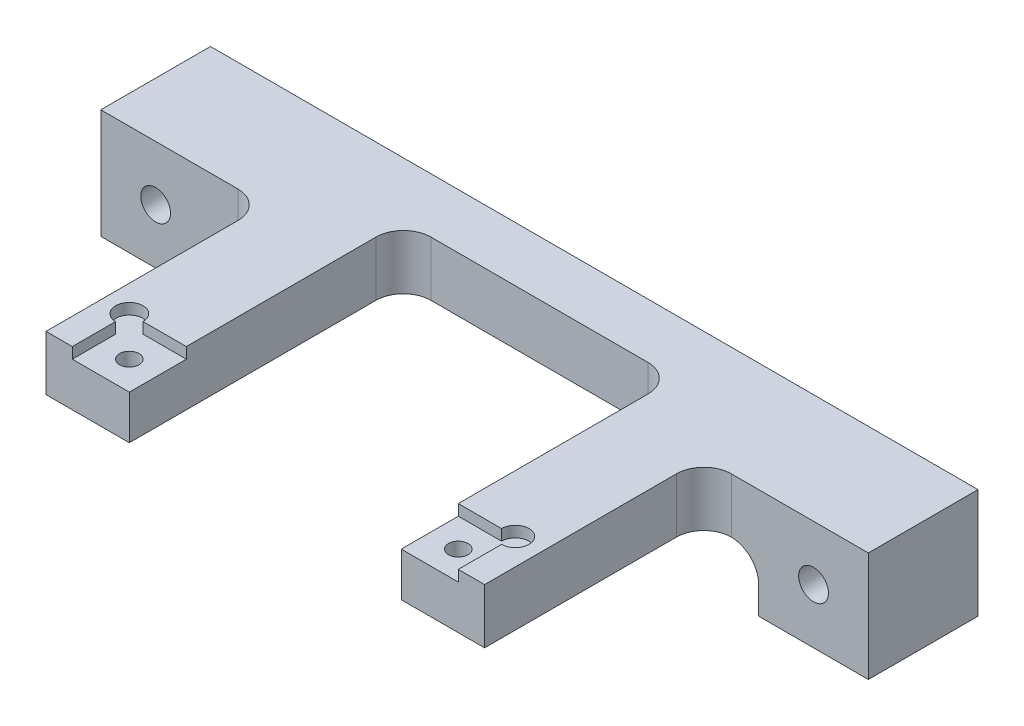
from build123d import *

# Parameters (mm, degrees)
SKETCH1_W             = 88.9
SKETCH1_H             = 38.1
BOSS_EXTRUDE1_DEPTH   = 12.7
SKETCH2_W             = 19.05
SKETCH2_H             = 25.4
CUT_EXTRUDE2_DEPTH    = 50.99995
SKETCH5_W             = 31.496
SKETCH5_H             = 31.75
CUT_EXTRUDE3_DEPTH    = 50.99995
BOSS_EXTRUDE2_START   = -6.35
BOSS_EXTRUDE2_DEPTH   = 6.35
SKETCH7_W             = 6.604
SKETCH7_H             = 6.604
CUT_EXTRUDE4_DEPTH    = 1.27
F_4_40_TAPPED_HOLE2_D = 2.2606
F_8_32_TAPPED_HOLE1_D = 3.4544
SKETCH20_R            = 1.5875
CUT_EXTRUDE5_DEPTH    = 1.27
FILLET3_R             = 3.175
SKETCH21_W            = 6.35
SKETCH21_H            = 12.7
CUT_EXTRUDE6_DEPTH    = 6.35
FILLET4_R             = 3.175
FILLET5_R             = 3.175
FILLET6_R             = 3.175
FILLET7_R             = 3.175


# Read off the part's stored shape, not the designer's step: Boss-Extrude2
with BuildPart() as part:
    # Sketch1 → Boss-Extrude1 (new body)
    with BuildSketch(Plane(origin=(0, 0, 0), x_dir=(1, 0, 0), z_dir=(0, 1, 0))):
        Rectangle(SKETCH1_W, SKETCH1_H)
    extrude(amount=-BOSS_EXTRUDE1_DEPTH)

    # Sketch2 → Cut-Extrude2 (cut, through all)
    with BuildSketch(Plane(origin=(0, 0, 0), x_dir=(1, 0, 0), z_dir=(0, 1, 0))):
        with Locations((-34.925, -6.35)):
            Rectangle(SKETCH2_W, SKETCH2_H)
        with Locations((34.925, -6.35)):
            Rectangle(SKETCH2_W, SKETCH2_H)
    extrude(amount=-CUT_EXTRUDE2_DEPTH, mode=Mode.SUBTRACT)

    # Sketch5 → Cut-Extrude3 (cut, through all)
    with BuildSketch(Plane(origin=(0, 0, 0), x_dir=(1, 0, 0), z_dir=(0, 1, 0))):
        with Locations((0, -3.175)):
            Rectangle(SKETCH5_W, SKETCH5_H)
    extrude(amount=-CUT_EXTRUDE3_DEPTH, mode=Mode.SUBTRACT)

    # Boss-Extrude2 outline → Boss-Extrude2 (cut)
    with BuildSketch(Plane.XZ.offset(12.7).offset(BOSS_EXTRUDE2_START)):
        Polygon((-25.4, 19.05), (-25.4, -19.05), (25.4, -19.05), (25.4, 19.05), (15.748, 19.05), (15.748, -12.7), (-15.748, -12.7), (-15.748, 19.05), align=None)
    extrude(amount=BOSS_EXTRUDE2_DEPTH, mode=Mode.SUBTRACT)

    # Sketch7 → Cut-Extrude4 (cut)
    with BuildSketch(Plane(origin=(0, 0, 0), x_dir=(1, 0, 0), z_dir=(0, 1, 0))):
        with Locations((-19.05, -15.748)):
            Rectangle(SKETCH7_W, SKETCH7_H)
        with Locations((19.05, -15.748)):
            Rectangle(SKETCH7_W, SKETCH7_H)
    extrude(amount=-CUT_EXTRUDE4_DEPTH, mode=Mode.SUBTRACT)

    # #4-40 Tapped Hole2 (through all)
    with Locations(Plane(origin=(-19.05, -1.27, 15.748), x_dir=(0, 0, 1), z_dir=(0, 1, 0))):
        with Locations((0, 0), (0, 38.1)):
            Hole(F_4_40_TAPPED_HOLE2_D / 2)

    # #8-32 Tapped Hole1 (through all)
    with Locations(Plane(origin=(-38.1, -6.35, -6.35), x_dir=(1, 0, 0), z_dir=(0, 0, 1))):
        with Locations((0, 0), (76.2, 0)):
            Hole(F_8_32_TAPPED_HOLE1_D / 2)

    # Sketch20 → Cut-Extrude5 (cut)
    with BuildSketch(Plane(origin=(0, 0, 0), x_dir=(1, 0, 0), z_dir=(0, 1, 0))):
        with Locations((-22.352, -12.446)):
            Circle(SKETCH20_R)
        with Locations((22.352, -12.446)):
            Circle(SKETCH20_R)
    extrude(amount=-CUT_EXTRUDE5_DEPTH, mode=Mode.SUBTRACT)

    # Fillet3
    fillet3_edges = [part.edges().sort_by_distance(p)[0] for p in [
        (15.748, -3.175, -12.7),
        (-15.748, -3.175, -12.7),
    ]]
    fillet(fillet3_edges, radius=FILLET3_R)

    # Sketch21 → Cut-Extrude6 (cut)
    with BuildSketch(Plane.XZ.offset(12.7)):
        with Locations((-28.575, -12.7)):
            Rectangle(SKETCH21_W, SKETCH21_H)
        with Locations((28.575, -12.7)):
            Rectangle(SKETCH21_W, SKETCH21_H)
    extrude(amount=-CUT_EXTRUDE6_DEPTH, mode=Mode.SUBTRACT)

    # Fillet4
    fillet4_edges = [part.edges().sort_by_distance(p)[0] for p in [
        (-31.75, -6.35, -12.7),
    ]]
    fillet(fillet4_edges, radius=FILLET4_R)

    # Fillet5
    fillet5_edges = [part.edges().sort_by_distance(p)[0] for p in [
        (31.75, -6.35, -12.7),
    ]]
    fillet(fillet5_edges, radius=FILLET5_R)

    # Fillet6
    fillet6_edges = [part.edges().sort_by_distance(p)[0] for p in [
        (-25.4, -3.175, -6.35),
    ]]
    fillet(fillet6_edges, radius=FILLET6_R)

    # Fillet7
    fillet7_edges = [part.edges().sort_by_distance(p)[0] for p in [
        (25.4, -3.175, -6.35),
    ]]
    fillet(fillet7_edges, radius=FILLET7_R)


solid = part.part
